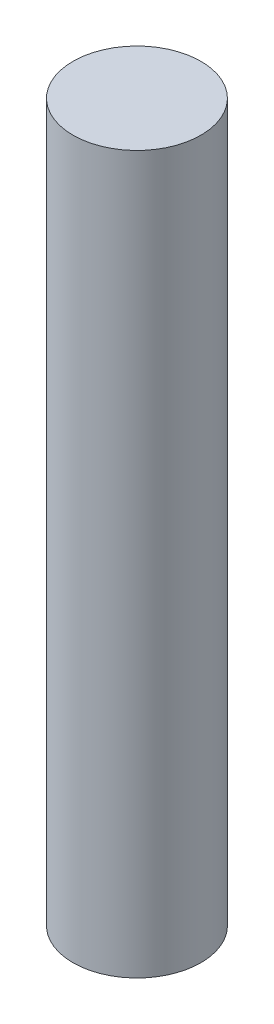
from build123d import *

# Parameters (mm, degrees)
SKETCH1_R           = 2.5
BOSS_EXTRUDE1_DEPTH = 28


with BuildPart() as part:
    # Sketch1 → Boss-Extrude1 (new body)
    with BuildSketch(Plane(origin=(0, 0, 0), x_dir=(1, 0, 0), z_dir=(0, 1, 0))):
        Circle(SKETCH1_R)
    extrude(amount=BOSS_EXTRUDE1_DEPTH)


solid = part.part
